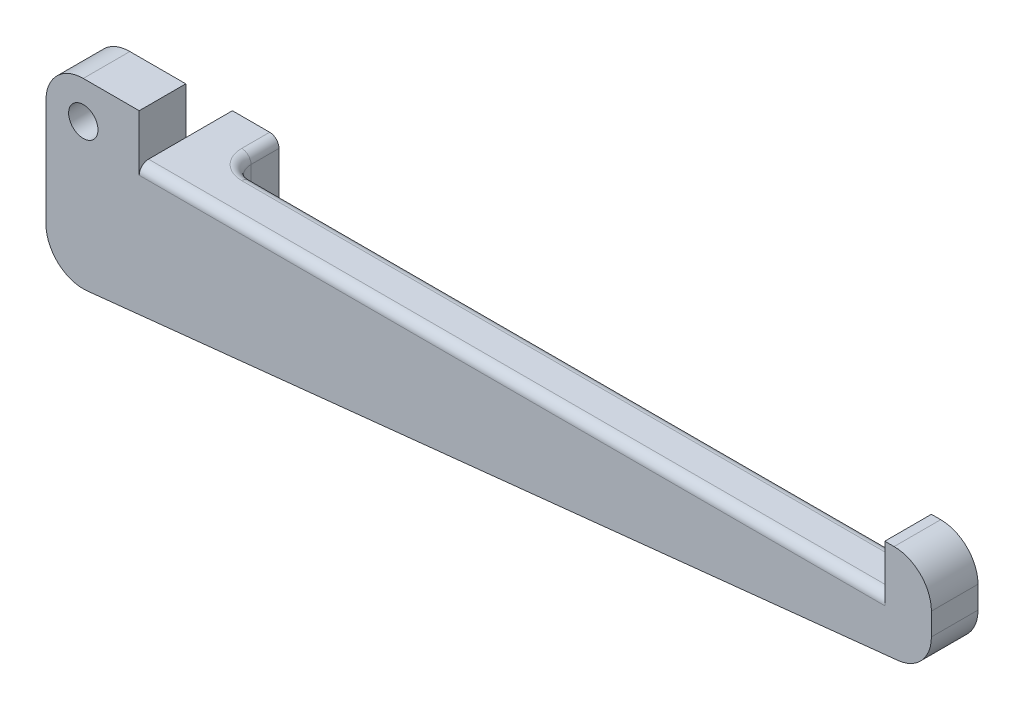
from build123d import *

# Parameters (mm, degrees)
BOSS_EXTRUDE1_DEPTH = 6.35
SKETCH2_W           = 6.35
SKETCH2_H           = 12.7
BOSS_EXTRUDE2_DEPTH = 6.35
FILLET1_R           = 2.54
FILLET2_R           = 1.27
SKETCH3_R           = 2
CUT_EXTRUDE1_DEPTH  = 6.35


with BuildPart() as part:
    # Sketch1 → Boss-Extrude1 (new body)
    with BuildSketch(Plane.XY):
        with BuildLine():
            Line((0, 0), (0, 7.62))
            ThreePointArc((0, 7.62), (1.487897552, 11.212102448), (5.08, 12.7))
            Line((5.08, 12.7), (12.7, 12.7))
            Line((12.7, 12.7), (12.7, 6.35))
            Line((12.7, 6.35), (114.3, 6.35))
            Line((114.3, 6.35), (114.3, 12.7))
            Line((114.3, 12.7), (115.57, 12.7))
            ThreePointArc((115.57, 12.7), (119.162102448, 11.212102448), (120.65, 7.62))
            Line((120.65, 7.62), (120.65, 4.57332967))
            ThreePointArc((120.65, 4.57332967), (119.34544285, 1.174442898), (116.101798705, -0.478758031))
            Line((116.101798705, -0.478758031), (5.611798705, -12.109284347))
            ThreePointArc((5.611798705, -12.109284347), (1.681113228, -10.832639496), (0, -7.057196646))
            Line((0, -7.057196646), (0, 0))
        make_face()
    extrude(amount=BOSS_EXTRUDE1_DEPTH)

    # Sketch2 → Boss-Extrude2 (add)
    with BuildSketch(Plane(origin=(0, 0, 0), x_dir=(-1, 0, 0), z_dir=(0, 0, -1))):
        with Locations((-15.875, 0)):
            Rectangle(SKETCH2_W, SKETCH2_H)
    extrude(amount=BOSS_EXTRUDE2_DEPTH)

    # Fillet1
    fillet1_edges = [part.edges().sort_by_distance(p)[0] for p in [
        (19.05, 0, 0),
    ]]
    fillet(fillet1_edges, radius=FILLET1_R)

    # Fillet2
    fillet2_edges = [part.edges().sort_by_distance(p)[0] for p in [
        (19.05, 6.35, -4.445),
        (19.793948776, 6.35, -0.743948776),
        (63.5, 6.35, 6.35),
        (67.945, 6.35, 0),
    ]]
    fillet(fillet2_edges, radius=FILLET2_R)

    # Sketch3 → Cut-Extrude1 (cut)
    with BuildSketch(Plane(origin=(0, 0, 0), x_dir=(-1, 0, 0), z_dir=(0, 0, -1))):
        with Locations((-5.08, 7.62)):
            Circle(SKETCH3_R)
    extrude(amount=-CUT_EXTRUDE1_DEPTH, mode=Mode.SUBTRACT)


solid = part.part
